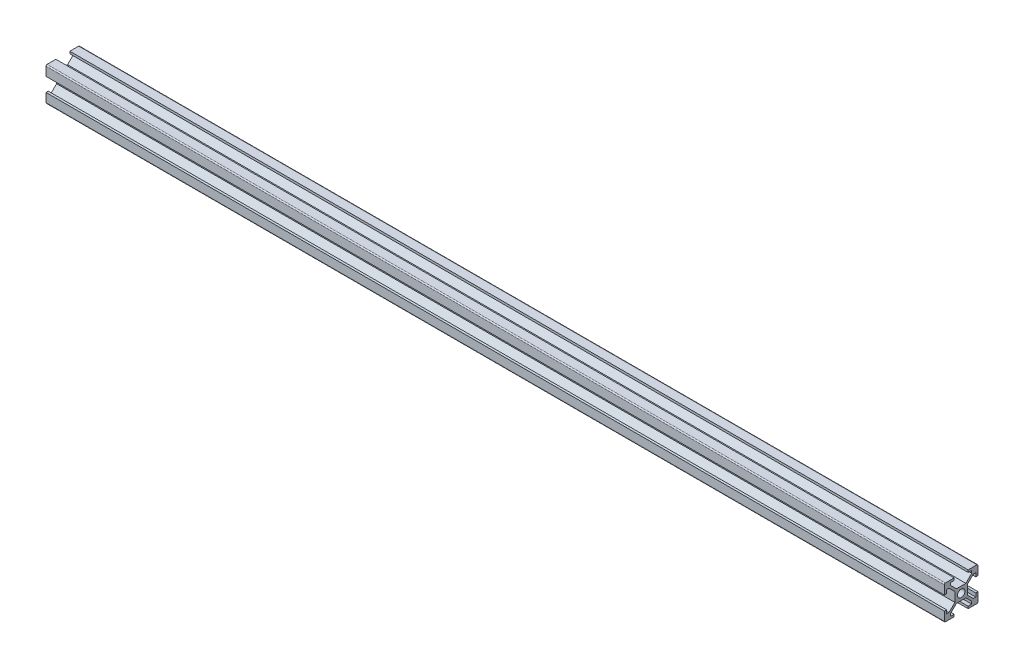
from build123d import *

# Parameters (mm, degrees)
EXTRUDE_1_DEPTH          = 400
CUT_EXTRUDE_2_DEPTH      = 401.140600289
CUT_EXTRUDE_2_DEPTH_BACK = 401.140600289
SKETCH_2_4_R             = 1.65


with BuildPart() as part:
    # 草图2 → 凸台-拉伸1 (new body)
    with BuildSketch(Plane(origin=(0, 0, 0), x_dir=(0, 0, -1), z_dir=(1, 0, 0))):
        with BuildLine():
            Line((-7, 7.5), (7, 7.5))
            ThreePointArc((7, 7.5), (7.353553391, 7.353553391), (7.5, 7))
            Line((7.5, 7), (7.5, -7))
            ThreePointArc((7.5, -7), (7.353553391, -7.353553391), (7, -7.5))
            Line((7, -7.5), (-7, -7.5))
            ThreePointArc((-7, -7.5), (-7.353553391, -7.353553391), (-7.5, -7))
            Line((-7.5, -7), (-7.5, 7))
            ThreePointArc((-7.5, 7), (-7.353553391, 7.353553391), (-7, 7.5))
        make_face()
    extrude(amount=EXTRUDE_1_DEPTH)

    # 草图2<4> → 切除-拉伸2 (cut, two sides: drawn at the far end of the back side and taken through both)
    with BuildSketch(Plane(origin=(0, 0, 0), x_dir=(0, 0, -1), z_dir=(1, 0, 0)).offset(-CUT_EXTRUDE_2_DEPTH_BACK)):
        Polygon((3.1, 7.5), (-3.1, 7.5), (-3.1, 6.5), (-4.7, 6.5), (-4.7, 5.407106781), (-2.092893219, 2.8), (2.092893219, 2.8), (4.7, 5.407106781), (4.7, 6.5), (3.1, 6.5), align=None)
        Polygon((-6.5, 3.1), (-7.5, 3.1), (-7.5, -3.1), (-6.5, -3.1), (-6.5, -4.7), (-5.407106781, -4.7), (-2.8, -2.092893219), (-2.8, 2.092893219), (-5.407106781, 4.7), (-6.5, 4.7), align=None)
        Polygon((7.5, -3.1), (7.5, 3.1), (6.5, 3.1), (6.5, 4.7), (5.407106781, 4.7), (2.8, 2.092893219), (2.8, -2.092893219), (5.407106781, -4.7), (6.5, -4.7), (6.5, -3.1), align=None)
        Polygon((-3.1, -6.5), (-3.1, -7.5), (3.1, -7.5), (3.1, -6.5), (4.7, -6.5), (4.7, -5.407106781), (2.092893219, -2.8), (-2.092893219, -2.8), (-4.7, -5.407106781), (-4.7, -6.5), align=None)
        Circle(SKETCH_2_4_R)
    extrude(amount=CUT_EXTRUDE_2_DEPTH + CUT_EXTRUDE_2_DEPTH_BACK, mode=Mode.SUBTRACT)


solid = part.part
